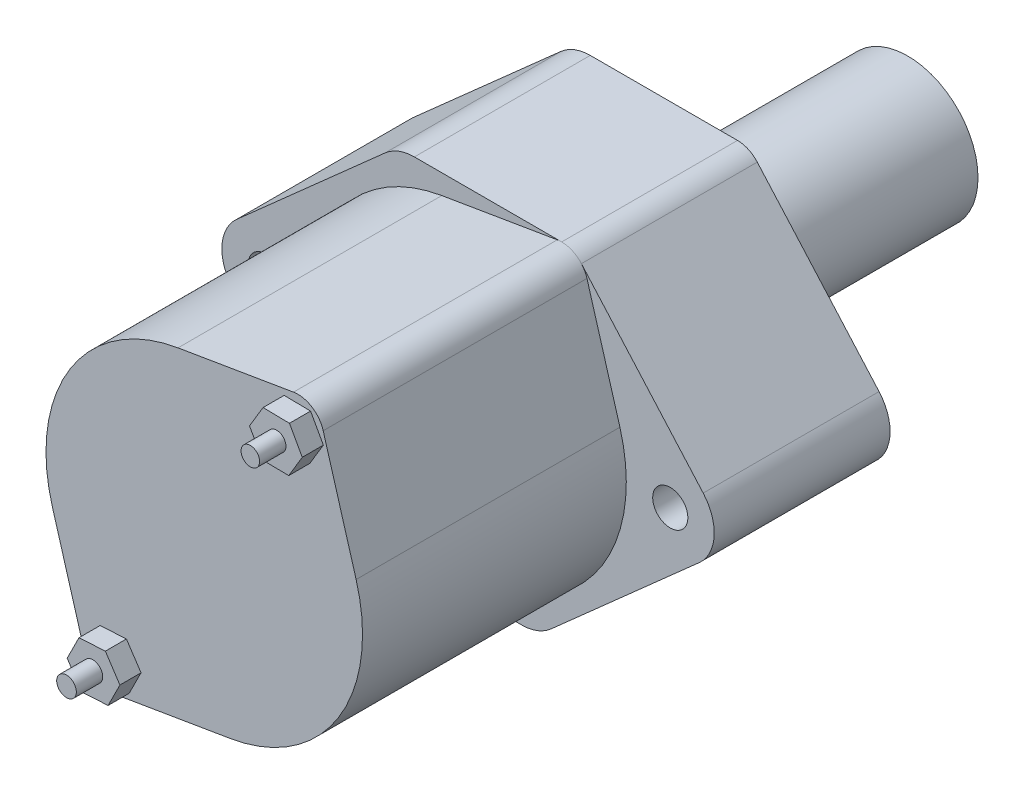
from build123d import *

# Parameters (mm, degrees)
SKETCH_1_R      = 1
EXTRUDE_1_DEPTH = 10
EXTRUDE_2_DEPTH = 15
SKETCH_3_R      = 4
EXTRUDE_3_DEPTH = 15
FILLET_1_R      = 1.5
FILLET_2_R      = 2.5
EXTRUDE_4_DEPTH = 1.2
SKETCH_9_R      = 0.527306968
EXTRUDE_5_DEPTH = 1.5
SKETCH_10_R     = 0.558325025
EXTRUDE_6_DEPTH = 1.5


with BuildPart() as part:
    # Эскиз1 → Вытянуть1 (new body)
    with BuildSketch(Plane.XY):
        with BuildLine():
            Line((9.501316689, 7.607009807), (19.501316689, 7.607009807))
            Line((19.501316689, 7.607009807), (28.660908483, 15.737315961))
            ThreePointArc((28.660908483, 15.737315961), (29.496729836, 17.455638669), (28.874738709, 19.262391918))
            Line((28.874738709, 19.262391918), (21.501316689, 27.607009807))
            Line((21.501316689, 27.607009807), (11.501316689, 27.607009807))
            Line((11.501316689, 27.607009807), (2.341724894, 19.476703653))
            ThreePointArc((2.341724894, 19.476703653), (1.505903541, 17.758380944), (2.127894668, 15.951627696))
            Line((2.127894668, 15.951627696), (9.501316689, 7.607009807))
        make_face()
        with Locations(Location((27.001316689, 17.607009807, 0), (0, 0, 180))):
            Circle(SKETCH_1_R, mode=Mode.SUBTRACT)
        with Locations(Location((4.001316689, 17.607009807, 0), (0, 0, 180))):
            Circle(SKETCH_1_R, mode=Mode.SUBTRACT)
    extrude(amount=EXTRUDE_1_DEPTH)

    # Эскиз2 → Вытянуть2 (add)
    with BuildSketch(Plane.XY.offset(10)):
        with BuildLine():
            Line((22.264471235, 26.529000138), (24.137824651, 20.138951792))
            ThreePointArc((24.137824651, 20.138951792), (23.128766256, 12.82977074), (16.993089347, 8.73150338))
            Line((16.993089347, 8.73150338), (10.426208912, 7.627758736))
            ThreePointArc((10.426208912, 7.627758736), (9.381373625, 7.835768212), (8.738162142, 8.685019476))
            Line((8.738162142, 8.685019476), (6.864808726, 15.075067822))
            ThreePointArc((6.864808726, 15.075067822), (7.873867121, 22.384248873), (14.00954403, 26.482516234))
            Line((14.00954403, 26.482516234), (20.576424465, 27.586260878))
            ThreePointArc((20.576424465, 27.586260878), (21.621259753, 27.378251401), (22.264471235, 26.529000138))
        make_face()
    extrude(amount=EXTRUDE_2_DEPTH)

    # Эскиз3 → Вытянуть3 (add)
    with BuildSketch(Plane(origin=(0, 0, 0), x_dir=(-1, 0, 0), z_dir=(0, 0, -1))):
        with Locations(Location((-15.501316689, 17.607009807, 0), (0, 0, 180))):
            Circle(SKETCH_3_R)
    extrude(amount=EXTRUDE_3_DEPTH)

    # Скругление1
    fillet_1_edges = [part.edges().sort_by_distance(p)[0] for p in [
        (9.501316689, 7.607009807, 5),
        (21.501316689, 27.607009807, 5),
    ]]
    fillet(fillet_1_edges, radius=FILLET_1_R - 0.0001)  # a hair under: the kernel refuses the full size

    # Скругление2
    fillet_2_edges = [part.edges().sort_by_distance(p)[0] for p in [
        (19.501316689, 7.607009807, 5),
        (11.501316689, 27.607009807, 5),
    ]]
    fillet(fillet_2_edges, radius=FILLET_2_R)

    # Эскиз8 → Вытянуть4 (add)
    with BuildSketch(Plane.XY.offset(25)):
        Polygon((20.046142028, 27.162033609), (19.274705601, 25.87537183), (20.003269175, 24.563957398), (21.503269175, 24.539204745), (22.274705601, 25.825866524), (21.546142028, 27.137280956), align=None)
        Polygon((11.07675483, 10.680633722), (9.57675483, 10.59059908), (8.904727117, 9.246543654), (9.732699404, 7.992522869), (11.232699404, 8.082557511), (11.904727117, 9.426612937), align=None)
    extrude(amount=EXTRUDE_4_DEPTH)

    # Эскиз9 → Вытянуть5 (add)
    with BuildSketch(Plane.XY.offset(26.2)):
        with Locations(Location((20.820913454, 25.904340038, 0), (0, 0, 180))):
            Circle(SKETCH_9_R)
    extrude(amount=EXTRUDE_5_DEPTH)

    # Эскиз10 → Вытянуть6 (add)
    with BuildSketch(Plane.XY.offset(26.2)):
        with Locations(Location((10.367828265, 9.340697632, 0), (0, 0, 180))):
            Circle(SKETCH_10_R)
    extrude(amount=EXTRUDE_6_DEPTH)


solid = part.part
